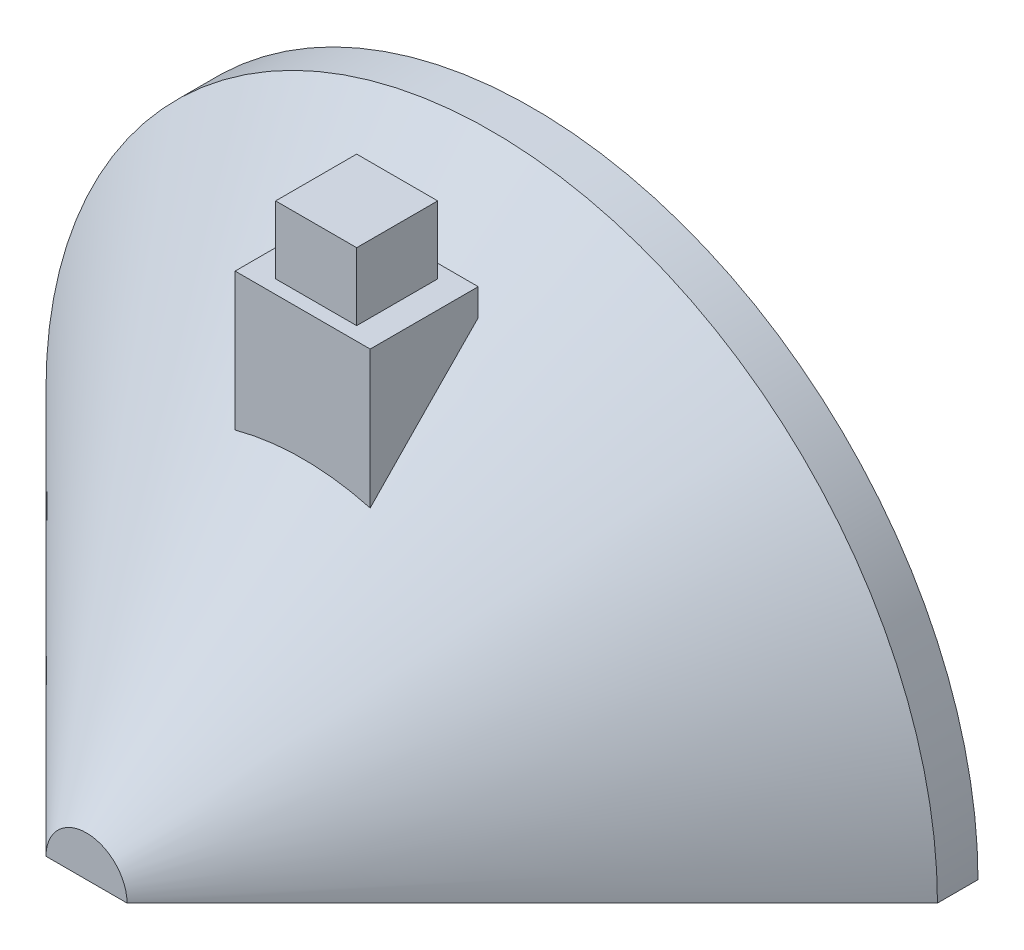
from build123d import *

# Parameters (mm, degrees)
REVOLVE2_ANGLE           = 180
BOSS_EXTRUDE1_DEPTH      = 6.35
BOSS_EXTRUDE1_DEPTH_BACK = 6.35
SKETCH10_W               = 7.62
SKETCH10_H               = 7.62
BOSS_EXTRUDE2_DEPTH      = 6.35


# Read off the part's stored shape, not the designer's step: Revolve2
with BuildPart() as part:
    # Revolve2 outline → Revolve2 (revolve)
    with BuildSketch(Plane.XZ):
        Polygon((3.81, 0), (0, 0), (0, -3.81), (38.1, -41.91), (41.91, -41.91), (41.91, -38.1), align=None)
    revolve(axis=Axis((0, 0, 0), (0, 0, 1)), revolution_arc=REVOLVE2_ANGLE)

    # Sketch6 → Boss-Extrude1 (add, two sides: drawn at the far end of the back side and taken through both)
    with BuildSketch(Plane(origin=(0, 0, 0), x_dir=(0, 0, -1), z_dir=(1, 0, 0)).offset(-BOSS_EXTRUDE1_DEPTH_BACK)):
        Polygon((20.32, 20.32), (20.32, 29.318948776), (20.32, 36.223650293), (30.48, 36.223650293), (30.48, 30.48), align=None)
    extrude(amount=BOSS_EXTRUDE1_DEPTH + BOSS_EXTRUDE1_DEPTH_BACK)

    # Sketch10 → Boss-Extrude2 (add)
    with BuildSketch(Plane(origin=(0, 36.223650293, 0), x_dir=(1, 0, 0), z_dir=(0, 1, 0))):
        with Locations((0, 25.4)):
            Rectangle(SKETCH10_W, SKETCH10_H)
    extrude(amount=BOSS_EXTRUDE2_DEPTH)


solid = part.part
